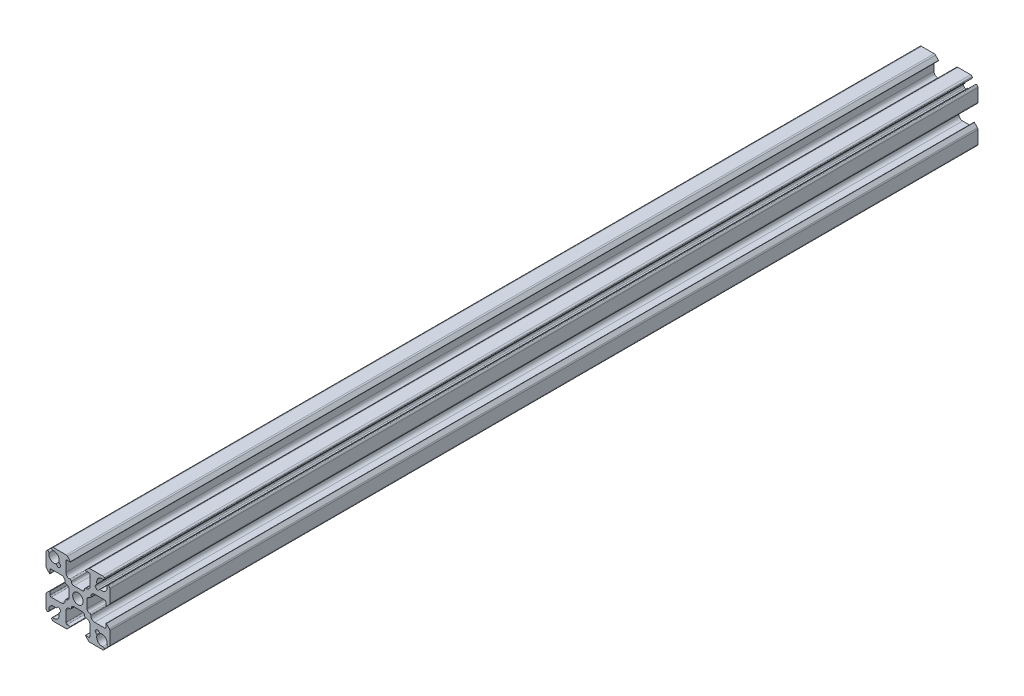
from build123d import *

# Parameters (mm, degrees)
SKETCH1_R                            = 2.08
BOSS_EXTRUDE1_DEPTH                  = 172.5549
SKETCH2_W                            = 2.5
SKETCH2_H                            = 16.3
TAP_DRILL_FOR_M6X1_0_TAP2_AT_2_COUNT = 2
TAP_DRILL_FOR_M6X1_0_TAP2_AT_2_PITCH = 120
TAP_DRILL_FOR_M6X1_0_TAP2_AT_3_COUNT = 2
TAP_DRILL_FOR_M6X1_0_TAP2_AT_3_PITCH = 240
SKETCH4_W                            = 2.5
SKETCH4_H                            = 16.3
TAP_DRILL_FOR_M6X1_0_TAP1_AT_2_COUNT = 2
TAP_DRILL_FOR_M6X1_0_TAP1_AT_2_PITCH = 120
TAP_DRILL_FOR_M6X1_0_TAP1_AT_3_COUNT = 2
TAP_DRILL_FOR_M6X1_0_TAP1_AT_3_PITCH = 240


with BuildPart() as part:
    # Sketch1 → Boss-Extrude1 (new, symmetric)
    with BuildSketch(Plane(origin=(0, 0, 0), x_dir=(-1, 0, 0), z_dir=(0, 0, -1))):
        with BuildLine():
            Line((-7.48853247, 8.61990332), (-6.985643798, 8.117014648))
            ThreePointArc((-6.985643798, 8.117014648), (-6.839197188, 7.763461257), (-6.985643798, 7.409907866))
            Line((-6.985643798, 7.409907866), (-7.409907866, 6.985643798))
            ThreePointArc((-7.409907866, 6.985643798), (-7.763461257, 6.839197188), (-8.117014648, 6.985643798))
            Line((-8.117014648, 6.985643798), (-8.61990332, 7.48853247))
            ThreePointArc((-8.61990332, 7.48853247), (-8.738774884, 7.554957329), (-8.874825936, 7.549228331))
            ThreePointArc((-8.874825936, 7.549228331), (-10.889377278, 7.955008076), (-11.572136222, 9.893284252))
            ThreePointArc((-11.572136222, 9.893284252), (-11.766795458, 10.383720777), (-12.292708824, 10.42656157))
            ThreePointArc((-12.292708824, 10.42656157), (-12.590129525, 10.150252615), (-12.7, 9.759440396))
            Line((-12.7, 9.759440396), (-12.7, 4.710660172))
            ThreePointArc((-12.7, 4.710660172), (-12.642909649, 4.423647598), (-12.480330086, 4.180330086))
            Line((-12.480330086, 4.180330086), (-11.270710678, 2.970710678))
            ThreePointArc((-11.270710678, 2.970710678), (-11.161731657, 2.949033403), (-11.1, 3.041421356))
            Line((-11.1, 3.041421356), (-11.1, 4.325))
            ThreePointArc((-11.1, 4.325), (-10.953553391, 4.678553391), (-10.6, 4.825))
            Line((-10.6, 4.825), (-6.6, 4.825))
            ThreePointArc((-6.6, 4.825), (-5.539339828, 4.385660172), (-5.1, 3.325))
            Line((-5.1, 3.325), (-5.1, 3.15))
            ThreePointArc((-5.1, 3.15), (-4.953553391, 2.796446609), (-4.6, 2.65))
            ThreePointArc((-4.6, 2.65), (-3.892893219, 2.357106781), (-3.6, 1.65))
            Line((-3.6, 1.65), (-3.6, -1.65))
            ThreePointArc((-3.6, -1.65), (-3.892893219, -2.357106781), (-4.6, -2.65))
            ThreePointArc((-4.6, -2.65), (-4.953553391, -2.796446609), (-5.1, -3.15))
            Line((-5.1, -3.15), (-5.1, -3.325))
            ThreePointArc((-5.1, -3.325), (-5.539339828, -4.385660172), (-6.6, -4.825))
            Line((-6.6, -4.825), (-10.6, -4.825))
            ThreePointArc((-10.6, -4.825), (-10.953553391, -4.678553391), (-11.1, -4.325))
            Line((-11.1, -4.325), (-11.1, -3.041421356))
            ThreePointArc((-11.1, -3.041421356), (-11.161731657, -2.949033403), (-11.270710678, -2.970710678))
            Line((-11.270710678, -2.970710678), (-12.480330086, -4.180330086))
            ThreePointArc((-12.480330086, -4.180330086), (-12.642909649, -4.423647598), (-12.7, -4.710660172))
            Line((-12.7, -4.710660172), (-12.7, -9.759440396))
            ThreePointArc((-12.7, -9.759440396), (-12.590129525, -10.150252615), (-12.292708824, -10.42656157))
            ThreePointArc((-12.292708824, -10.42656157), (-11.766795458, -10.383720777), (-11.572136222, -9.893284252))
            ThreePointArc((-11.572136222, -9.893284252), (-10.889377278, -7.955008076), (-8.874825936, -7.549228331))
            ThreePointArc((-8.874825936, -7.549228331), (-8.738774884, -7.554957329), (-8.61990332, -7.48853247))
            Line((-8.61990332, -7.48853247), (-8.117014648, -6.985643798))
            ThreePointArc((-8.117014648, -6.985643798), (-7.763461257, -6.839197188), (-7.409907866, -6.985643798))
            Line((-7.409907866, -6.985643798), (-6.985643798, -7.409907866))
            ThreePointArc((-6.985643798, -7.409907866), (-6.839197188, -7.763461257), (-6.985643798, -8.117014648))
            Line((-6.985643798, -8.117014648), (-7.48853247, -8.61990332))
            ThreePointArc((-7.48853247, -8.61990332), (-7.554957329, -8.738774884), (-7.549228331, -8.874825936))
            ThreePointArc((-7.549228331, -8.874825936), (-7.955008076, -10.889377278), (-9.893284252, -11.572136222))
            ThreePointArc((-9.893284252, -11.572136222), (-10.383720777, -11.766795458), (-10.42656157, -12.292708824))
            ThreePointArc((-10.42656157, -12.292708824), (-10.150252615, -12.590129525), (-9.759440396, -12.7))
            Line((-9.759440396, -12.7), (-4.710660172, -12.7))
            ThreePointArc((-4.710660172, -12.7), (-4.423647598, -12.642909649), (-4.180330086, -12.480330086))
            Line((-4.180330086, -12.480330086), (-2.970710678, -11.270710678))
            ThreePointArc((-2.970710678, -11.270710678), (-2.949033403, -11.161731657), (-3.041421356, -11.1))
            Line((-3.041421356, -11.1), (-4.325, -11.1))
            ThreePointArc((-4.325, -11.1), (-4.678553391, -10.953553391), (-4.825, -10.6))
            Line((-4.825, -10.6), (-4.825, -6.6))
            ThreePointArc((-4.825, -6.6), (-4.385660172, -5.539339828), (-3.325, -5.1))
            Line((-3.325, -5.1), (-3.15, -5.1))
            ThreePointArc((-3.15, -5.1), (-2.796446609, -4.953553391), (-2.65, -4.6))
            ThreePointArc((-2.65, -4.6), (-2.357106781, -3.892893219), (-1.65, -3.6))
            Line((-1.65, -3.6), (1.65, -3.6))
            ThreePointArc((1.65, -3.6), (2.357106781, -3.892893219), (2.65, -4.6))
            ThreePointArc((2.65, -4.6), (2.796446609, -4.953553391), (3.15, -5.1))
            Line((3.15, -5.1), (3.325, -5.1))
            ThreePointArc((3.325, -5.1), (4.385660172, -5.539339828), (4.825, -6.6))
            Line((4.825, -6.6), (4.825, -10.6))
            ThreePointArc((4.825, -10.6), (4.678553391, -10.953553391), (4.325, -11.1))
            Line((4.325, -11.1), (3.041421356, -11.1))
            ThreePointArc((3.041421356, -11.1), (2.949033403, -11.161731657), (2.970710678, -11.270710678))
            Line((2.970710678, -11.270710678), (4.180330086, -12.480330086))
            ThreePointArc((4.180330086, -12.480330086), (4.423647598, -12.642909649), (4.710660172, -12.7))
            Line((4.710660172, -12.7), (9.759440396, -12.7))
            ThreePointArc((9.759440396, -12.7), (10.150252615, -12.590129525), (10.42656157, -12.292708824))
            ThreePointArc((10.42656157, -12.292708824), (10.383720777, -11.766795458), (9.893284252, -11.572136222))
            ThreePointArc((9.893284252, -11.572136222), (7.955008076, -10.889377278), (7.549228331, -8.874825936))
            ThreePointArc((7.549228331, -8.874825936), (7.554957329, -8.738774884), (7.48853247, -8.61990332))
            Line((7.48853247, -8.61990332), (6.985643798, -8.117014648))
            ThreePointArc((6.985643798, -8.117014648), (6.839197188, -7.763461257), (6.985643798, -7.409907866))
            Line((6.985643798, -7.409907866), (7.409907866, -6.985643798))
            ThreePointArc((7.409907866, -6.985643798), (7.763461257, -6.839197188), (8.117014648, -6.985643798))
            Line((8.117014648, -6.985643798), (8.61990332, -7.48853247))
            ThreePointArc((8.61990332, -7.48853247), (8.738774884, -7.554957329), (8.874825936, -7.549228331))
            ThreePointArc((8.874825936, -7.549228331), (10.889377278, -7.955008076), (11.572136222, -9.893284252))
            ThreePointArc((11.572136222, -9.893284252), (11.766795458, -10.383720777), (12.292708824, -10.42656157))
            ThreePointArc((12.292708824, -10.42656157), (12.590129525, -10.150252615), (12.7, -9.759440396))
            Line((12.7, -9.759440396), (12.7, -4.710660172))
            ThreePointArc((12.7, -4.710660172), (12.642909649, -4.423647598), (12.480330086, -4.180330086))
            Line((12.480330086, -4.180330086), (11.270710678, -2.970710678))
            ThreePointArc((11.270710678, -2.970710678), (11.161731657, -2.949033403), (11.1, -3.041421356))
            Line((11.1, -3.041421356), (11.1, -4.325))
            ThreePointArc((11.1, -4.325), (10.953553391, -4.678553391), (10.6, -4.825))
            Line((10.6, -4.825), (6.6, -4.825))
            ThreePointArc((6.6, -4.825), (5.539339828, -4.385660172), (5.1, -3.325))
            Line((5.1, -3.325), (5.1, -3.15))
            ThreePointArc((5.1, -3.15), (4.953553391, -2.796446609), (4.6, -2.65))
            ThreePointArc((4.6, -2.65), (3.892893219, -2.357106781), (3.6, -1.65))
            Line((3.6, -1.65), (3.6, 1.65))
            ThreePointArc((3.6, 1.65), (3.892893219, 2.357106781), (4.6, 2.65))
            ThreePointArc((4.6, 2.65), (4.953553391, 2.796446609), (5.1, 3.15))
            Line((5.1, 3.15), (5.1, 3.325))
            ThreePointArc((5.1, 3.325), (5.539339828, 4.385660172), (6.6, 4.825))
            Line((6.6, 4.825), (10.6, 4.825))
            ThreePointArc((10.6, 4.825), (10.953553391, 4.678553391), (11.1, 4.325))
            Line((11.1, 4.325), (11.1, 3.041421356))
            ThreePointArc((11.1, 3.041421356), (11.161731657, 2.949033403), (11.270710678, 2.970710678))
            Line((11.270710678, 2.970710678), (12.480330086, 4.180330086))
            ThreePointArc((12.480330086, 4.180330086), (12.642909649, 4.423647598), (12.7, 4.710660172))
            Line((12.7, 4.710660172), (12.7, 9.759440396))
            ThreePointArc((12.7, 9.759440396), (12.590129525, 10.150252615), (12.292708824, 10.42656157))
            ThreePointArc((12.292708824, 10.42656157), (11.766795458, 10.383720777), (11.572136222, 9.893284252))
            ThreePointArc((11.572136222, 9.893284252), (10.889377278, 7.955008076), (8.874825936, 7.549228331))
            ThreePointArc((8.874825936, 7.549228331), (8.738774884, 7.554957329), (8.61990332, 7.48853247))
            Line((8.61990332, 7.48853247), (8.117014648, 6.985643798))
            ThreePointArc((8.117014648, 6.985643798), (7.763461257, 6.839197188), (7.409907866, 6.985643798))
            Line((7.409907866, 6.985643798), (6.985643798, 7.409907866))
            ThreePointArc((6.985643798, 7.409907866), (6.839197188, 7.763461257), (6.985643798, 8.117014648))
            Line((6.985643798, 8.117014648), (7.48853247, 8.61990332))
            ThreePointArc((7.48853247, 8.61990332), (7.554957329, 8.738774884), (7.549228331, 8.874825936))
            ThreePointArc((7.549228331, 8.874825936), (7.955008076, 10.889377278), (9.893284252, 11.572136222))
            ThreePointArc((9.893284252, 11.572136222), (10.383720777, 11.766795458), (10.42656157, 12.292708824))
            ThreePointArc((10.42656157, 12.292708824), (10.150252615, 12.590129525), (9.759440396, 12.7))
            Line((9.759440396, 12.7), (4.710660172, 12.7))
            ThreePointArc((4.710660172, 12.7), (4.423647598, 12.642909649), (4.180330086, 12.480330086))
            Line((4.180330086, 12.480330086), (2.970710678, 11.270710678))
            ThreePointArc((2.970710678, 11.270710678), (2.949033403, 11.161731657), (3.041421356, 11.1))
            Line((3.041421356, 11.1), (4.325, 11.1))
            ThreePointArc((4.325, 11.1), (4.678553391, 10.953553391), (4.825, 10.6))
            Line((4.825, 10.6), (4.825, 6.6))
            ThreePointArc((4.825, 6.6), (4.385660172, 5.539339828), (3.325, 5.1))
            Line((3.325, 5.1), (3.15, 5.1))
            ThreePointArc((3.15, 5.1), (2.796446609, 4.953553391), (2.65, 4.6))
            ThreePointArc((2.65, 4.6), (2.357106781, 3.892893219), (1.65, 3.6))
            Line((1.65, 3.6), (-1.65, 3.6))
            ThreePointArc((-1.65, 3.6), (-2.357106781, 3.892893219), (-2.65, 4.6))
            ThreePointArc((-2.65, 4.6), (-2.796446609, 4.953553391), (-3.15, 5.1))
            Line((-3.15, 5.1), (-3.325, 5.1))
            ThreePointArc((-3.325, 5.1), (-4.385660172, 5.539339828), (-4.825, 6.6))
            Line((-4.825, 6.6), (-4.825, 10.6))
            ThreePointArc((-4.825, 10.6), (-4.678553391, 10.953553391), (-4.325, 11.1))
            Line((-4.325, 11.1), (-3.041421356, 11.1))
            ThreePointArc((-3.041421356, 11.1), (-2.949033403, 11.161731657), (-2.970710678, 11.270710678))
            Line((-2.970710678, 11.270710678), (-4.180330086, 12.480330086))
            ThreePointArc((-4.180330086, 12.480330086), (-4.423647598, 12.642909649), (-4.710660172, 12.7))
            Line((-4.710660172, 12.7), (-9.759440396, 12.7))
            ThreePointArc((-9.759440396, 12.7), (-10.150252615, 12.590129525), (-10.42656157, 12.292708824))
            ThreePointArc((-10.42656157, 12.292708824), (-10.383720777, 11.766795458), (-9.893284252, 11.572136222))
            ThreePointArc((-9.893284252, 11.572136222), (-7.955008076, 10.889377278), (-7.549228331, 8.874825936))
            ThreePointArc((-7.549228331, 8.874825936), (-7.554957329, 8.738774884), (-7.48853247, 8.61990332))
        make_face()
        Circle(SKETCH1_R, mode=Mode.SUBTRACT)
    extrude(amount=BOSS_EXTRUDE1_DEPTH, both=True)

    # Sketch2 → Tap Drill for M6x1.0 Tap2 (revolve, cut)
    with BuildSketch(Plane(origin=(3.6, -0.067349518, 132.55489999), x_dir=(0, 0, -1), z_dir=(0, 1, 0))):
        with Locations((1.25, 8.15)):
            Rectangle(SKETCH2_W, SKETCH2_H)
    tap_drill_for_m6x1_0_tap2 = revolve(axis=Axis((9.95, -0.067349518, 132.55489999), (-1, 0, 0)), mode=Mode.SUBTRACT)

    # Tap Drill for M6x1.0 Tap2 at 2: Tap Drill for M6x1.0 Tap2 ×2
    with Locations(*[(0, 0, -i * TAP_DRILL_FOR_M6X1_0_TAP2_AT_2_PITCH) for i in range(1, TAP_DRILL_FOR_M6X1_0_TAP2_AT_2_COUNT)]):
        add(tap_drill_for_m6x1_0_tap2, mode=Mode.SUBTRACT)

    # Tap Drill for M6x1.0 Tap2 at 3: Tap Drill for M6x1.0 Tap2 ×2
    with Locations(*[(0, 0, -i * TAP_DRILL_FOR_M6X1_0_TAP2_AT_3_PITCH) for i in range(1, TAP_DRILL_FOR_M6X1_0_TAP2_AT_3_COUNT)]):
        add(tap_drill_for_m6x1_0_tap2, mode=Mode.SUBTRACT)

    # Sketch4 → Tap Drill for M6x1.0 Tap1 (revolve, cut)
    with BuildSketch(Plane(origin=(-3.6, 0, 151.537550472), x_dir=(0, 0, 1), z_dir=(0, 1, 0))):
        with Locations((1.25, 8.15)):
            Rectangle(SKETCH4_W, SKETCH4_H)
    tap_drill_for_m6x1_0_tap1 = revolve(axis=Axis((-9.95, 0, 151.537550472), (1, 0, 0)), mode=Mode.SUBTRACT)

    # Tap Drill for M6x1.0 Tap1 at 2: Tap Drill for M6x1.0 Tap1 ×2
    with Locations(*[(0, 0, -i * TAP_DRILL_FOR_M6X1_0_TAP1_AT_2_PITCH) for i in range(1, TAP_DRILL_FOR_M6X1_0_TAP1_AT_2_COUNT)]):
        add(tap_drill_for_m6x1_0_tap1, mode=Mode.SUBTRACT)

    # Tap Drill for M6x1.0 Tap1 at 3: Tap Drill for M6x1.0 Tap1 ×2
    with Locations(*[(0, 0, -i * TAP_DRILL_FOR_M6X1_0_TAP1_AT_3_PITCH) for i in range(1, TAP_DRILL_FOR_M6X1_0_TAP1_AT_3_COUNT)]):
        add(tap_drill_for_m6x1_0_tap1, mode=Mode.SUBTRACT)


solid = part.part
